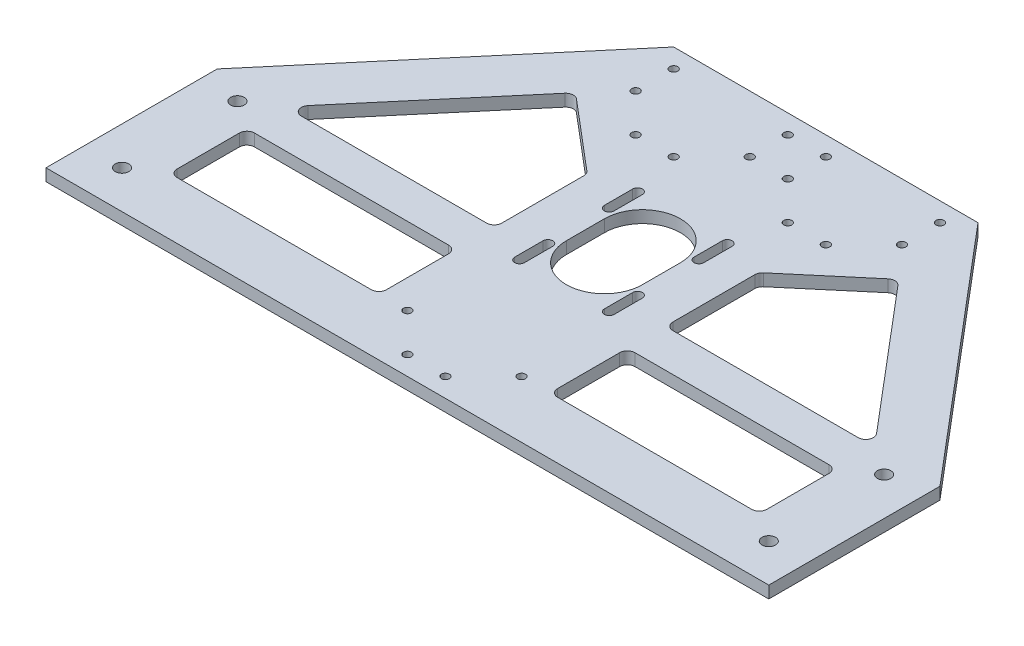
from build123d import *

# Parameters (mm, degrees)
BOSS_EXTRUDE1_DEPTH                 = 6.35
M5X0_8_TAPPED_HOLE1_D               = 4.2
F_7_1_7_1_DIAMETER_HOLE1_D          = 7.1
F_5_0MM_CLEARANCE_DOWEL_SLOT2_DEPTH = 6.35
CUT_EXTRUDE1_DEPTH                  = 10
SKETCH18_W                          = 110
SKETCH18_H                          = 40.64
CUT_EXTRUDE2_DEPTH                  = 10
FILLET1_R                           = 4
FILLET1_OF_MIRROR1_R                = 4


# Read off the part's stored shape, not the designer's step: Ø5.0mm Clearance Dowel Slot2
with BuildPart() as part:
    # Sketch1 → Boss-Extrude1 (new body)
    with BuildSketch(Plane(origin=(0, 0, 0), x_dir=(1, 0, 0), z_dir=(0, 1, 0))):
        Polygon((0, 0), (160, 0), (270, -130), (270, -220), (-110, -220), (-110, -130), align=None)
    extrude(amount=BOSS_EXTRUDE1_DEPTH)

    # M5x0.8 Tapped Hole1 (through all)
    with Locations(Plane(origin=(0, 6.35, 0), x_dir=(1, 0, 0), z_dir=(0, 1, 0))):
        with Locations((10, -10), (150, -10), (150, -30), (10, -30), (30, -50), (50, -50), (110, -50), (130, -50), (90, -10), (90, -30), (70, -10), (70, -30), (70, -210), (90, -210), (50, -190), (110, -190)):
            Hole(M5X0_8_TAPPED_HOLE1_D / 2)

    # Ø7.1 (7.1) Diameter Hole1 (through all)
    with Locations(Plane(origin=(0, 6.35, 0), x_dir=(1, 0, 0), z_dir=(0, 1, 0))):
        with Locations((250, -139.36), (250, -200), (-90, -200), (-90, -139.36)):
            Hole(F_7_1_7_1_DIAMETER_HOLE1_D / 2)

    # Ø5.0mm Clearance Dowel Slot2 outline → Ø5.0mm Clearance Dowel Slot2 (cut)
    with BuildSketch(Plane(origin=(0, 0, 0), x_dir=(1, 0, 0), z_dir=(0, 1, 0))):
        with BuildLine():
            Line((58.98, -90.31), (58.98, -75.41))
            ThreePointArc((58.98, -75.41), (56.43, -72.86), (53.88, -75.41))
            Line((53.88, -75.41), (53.88, -90.31))
            ThreePointArc((53.88, -90.31), (56.43, -92.86), (58.98, -90.31))
        make_face()
        with BuildLine():
            ThreePointArc((58.98, -122.55), (56.43, -120), (53.88, -122.55))
            Line((53.88, -122.55), (53.88, -137.45))
            ThreePointArc((53.88, -137.45), (56.43, -140), (58.98, -137.45))
            Line((58.98, -137.45), (58.98, -122.55))
        make_face()
        with BuildLine():
            Line((106.12, -90.31), (106.12, -75.41))
            ThreePointArc((106.12, -75.41), (103.57, -72.86), (101.02, -75.41))
            Line((101.02, -75.41), (101.02, -90.31))
            ThreePointArc((101.02, -90.31), (103.57, -92.86), (106.12, -90.31))
        make_face()
        with BuildLine():
            ThreePointArc((106.12, -122.55), (103.57, -120), (101.02, -122.55))
            Line((101.02, -122.55), (101.02, -137.45))
            ThreePointArc((101.02, -137.45), (103.57, -140), (106.12, -137.45))
            Line((106.12, -137.45), (106.12, -122.55))
        make_face()
    extrude(amount=F_5_0MM_CLEARANCE_DOWEL_SLOT2_DEPTH, mode=Mode.SUBTRACT)

    # Sketch17 → Cut-Extrude1 (cut)
    with BuildSketch(Plane(origin=(0, 6.35, 0), x_dir=(1, 0, 0), z_dir=(0, 1, 0))):
        with BuildLine():
            Line((100, -96.43), (100, -116.43))
            ThreePointArc((100, -116.43), (80, -136.43), (60, -116.43))
            Line((60, -116.43), (60, -96.43))
            ThreePointArc((60, -96.43), (80, -76.43), (100, -96.43))
        make_face()
    extrude(amount=-CUT_EXTRUDE1_DEPTH, mode=Mode.SUBTRACT)

    # Sketch18 → Cut-Extrude2 (cut)
    with BuildSketch(Plane(origin=(0, 6.35, 0), x_dir=(1, 0, 0), z_dir=(0, 1, 0))):
        Polygon((-75, -129.36), (-4.975810347, -46.6041395), (35, -80.429825178), (35, -129.36), align=None)
        with Locations((-20, -169.68)):
            Rectangle(SKETCH18_W, SKETCH18_H)
    cut_extrude2 = extrude(amount=-CUT_EXTRUDE2_DEPTH, mode=Mode.SUBTRACT)

    # Fillet1
    fillet1_edges = [part.edges().sort_by_distance(p)[0] for p in [
        (-75, 3.175, 190),
        (-75, 3.175, 149.36),
        (35, 3.175, 149.36),
        (35, 3.175, 190),
        (35, 3.175, 129.36),
        (-75, 3.175, 129.36),
        (-4.975810347, 3.175, 46.6041395),
        (35, 3.175, 80.429825178),
    ]]
    fillet(fillet1_edges, radius=FILLET1_R)

    # Mirror1: Cut-Extrude2 across plane
    add(cut_extrude2.mirror(Plane.ZY.offset(-80)), mode=Mode.SUBTRACT)

    # Fillet1 of Mirror1
    fillet1_of_mirror1_edges = [part.edges().sort_by_distance(p)[0] for p in [
        (235, 3.175, 190),
        (235, 3.175, 149.36),
        (125, 3.175, 149.36),
        (125, 3.175, 190),
        (125, 3.175, 129.36),
        (235, 3.175, 129.36),
        (164.975810347, 3.175, 46.6041395),
        (125, 3.175, 80.429825178),
    ]]
    fillet(fillet1_of_mirror1_edges, radius=FILLET1_OF_MIRROR1_R)


solid = part.part
